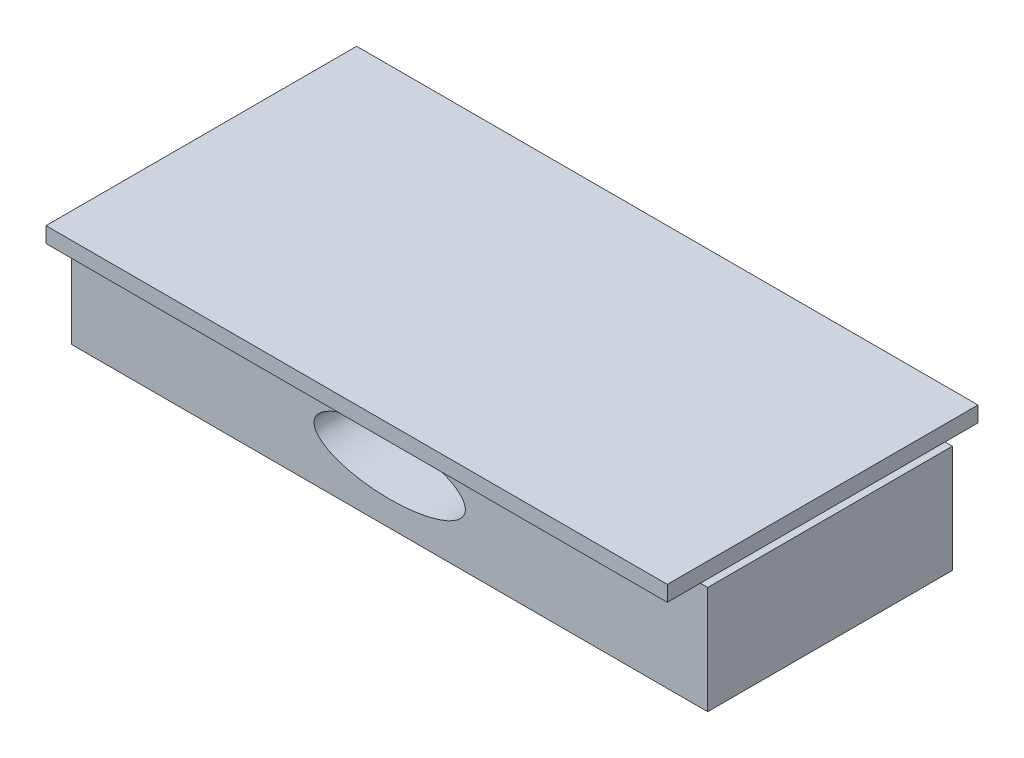
from build123d import *

# Parameters (mm, degrees)
SKETCH1_W           = 130
SKETCH1_H           = 50
BOSS_EXTRUDE1_DEPTH = 22
SKETCH2_RX          = 15.461746976
SKETCH2_RY          = 5.884694745
CUT_EXTRUDE1_DEPTH  = 85.905830189
SKETCH3_W           = 127
SKETCH3_H           = 63.5
BOSS_EXTRUDE2_DEPTH = 3.175


with BuildPart() as part:
    # Sketch1 → Boss-Extrude1 (new body)
    with BuildSketch(Plane(origin=(0, 0, 0), x_dir=(1, 0, 0), z_dir=(0, 1, 0))):
        Rectangle(SKETCH1_W, SKETCH1_H)
    extrude(amount=BOSS_EXTRUDE1_DEPTH)

    # Sketch2 → Cut-Extrude1 (cut, through all)
    with BuildSketch(Plane.XY.offset(25)):
        with Locations((0, 11)):
            Ellipse(SKETCH2_RX, SKETCH2_RY)
    extrude(amount=-CUT_EXTRUDE1_DEPTH, mode=Mode.SUBTRACT)

    # Sketch3 → Boss-Extrude2 (add)
    with BuildSketch(Plane(origin=(0, 22, 0), x_dir=(1, 0, 0), z_dir=(0, 1, 0))):
        Rectangle(SKETCH3_W, SKETCH3_H)
    extrude(amount=BOSS_EXTRUDE2_DEPTH)


solid = part.part
